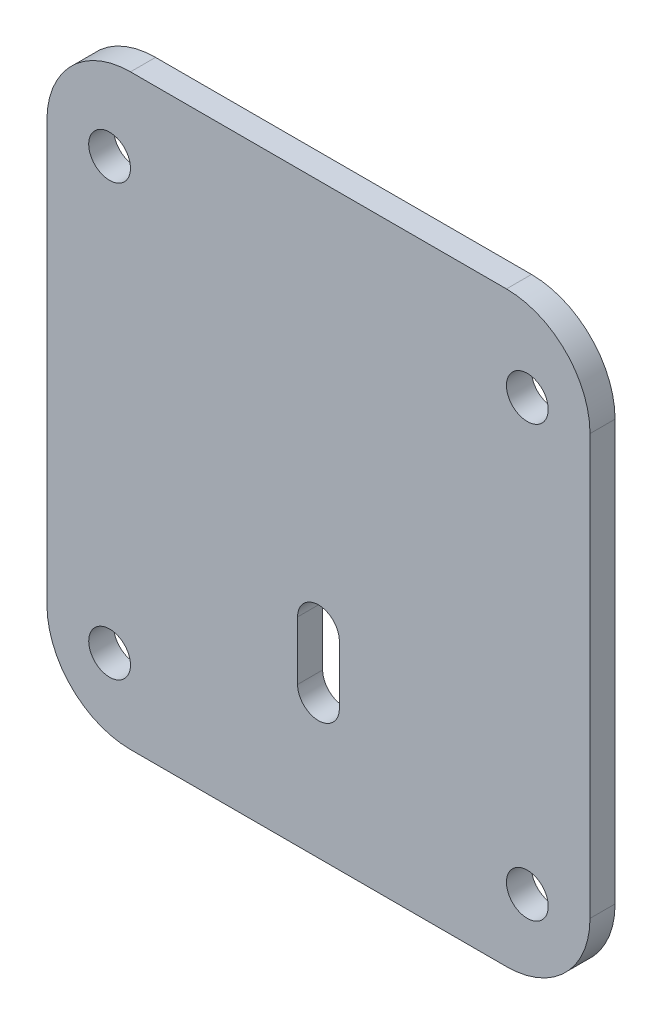
from build123d import *

# Parameters (mm, degrees)
SKETCH1_R           = 2.5
BOSS_EXTRUDE1_DEPTH = 3
FILLET1_R           = 10
FILLET1_R_2         = 15
FILLET1_R_3         = 50
SKETCH2_R           = 1.75
SKETCH2_R_2         = 12
CUT_EXTRUDE1_DEPTH  = 82.389898264
SKETCH4_W           = 65
SKETCH4_H           = 34.30914122
CUT_EXTRUDE2_DEPTH  = 82.389898264
FILLET2_R           = 10
SKETCH5_R           = 2.5
CUT_EXTRUDE3_DEPTH  = 52.820000965


with BuildPart() as part:
    # Sketch1 → Boss-Extrude1 (new body)
    with BuildSketch(Plane.XY):
        Polygon((-32.5, 30), (32.5, 30), (32.5, -62.640754554), (0, -87.640754554), (-32.5, -62.640754554), align=None)
        with Locations((25, 20)):
            Circle(SKETCH1_R, mode=Mode.SUBTRACT)
        with Locations((-25, 20)):
            Circle(SKETCH1_R, mode=Mode.SUBTRACT)
        with BuildLine():
            Line((2.5, -16.5), (2.5, -23.5))
            ThreePointArc((2.5, -23.5), (0, -26), (-2.5, -23.5))
            Line((-2.5, -23.5), (-2.5, -16.5))
            ThreePointArc((-2.5, -16.5), (0, -14), (2.5, -16.5))
        make_face(mode=Mode.SUBTRACT)
    extrude(amount=BOSS_EXTRUDE1_DEPTH)

    # Fillet1
    # the kernel refuses this fillet: 50, 15, 10 mm, written as the material it takes off along each edge
    with BuildSketch(Plane(origin=(32.5, 30, -25), x_dir=(-1, 0, 0), z_dir=(0, 0, 1))) as fillet1_piece_1:
        with BuildLine():
            CenterArc((FILLET1_R, FILLET1_R), FILLET1_R, 180, 90)
            Line((0, FILLET1_R), (0, 0))
            Line((0, 0), (FILLET1_R, 0))
        make_face()
    extrude(amount=53, mode=Mode.SUBTRACT)
    with BuildSketch(Plane(origin=(-32.5, 30, -25), x_dir=(1, 0, 0), z_dir=(0, 0, 1))) as fillet1_piece_2:
        with BuildLine():
            CenterArc((FILLET1_R, -FILLET1_R), FILLET1_R, 90, 90)
            Line((0, -FILLET1_R), (0, 0))
            Line((0, 0), (FILLET1_R, 0))
        make_face()
    extrude(amount=53, mode=Mode.SUBTRACT)
    with BuildSketch(Plane(origin=(-32.5, -62.640754554, -18.465056154), x_dir=(0.7926239891046004, -0.6097107608496921, 0), z_dir=(0, 0, 1)), Plane(origin=(32.5, -62.640754554, -18.465056154), x_dir=(0, 1, 0), z_dir=(0, 0, 1))) as fillet1_piece_3:
        with BuildLine():
            CenterArc((FILLET1_R_2 * 0.492401497451, FILLET1_R_2), FILLET1_R_2, 217.568592029, 52.431407971)
            Line((-FILLET1_R_2 * 0.300222491654, FILLET1_R_2 * 0.39028923915), (0, 0))
            Line((0, 0), (FILLET1_R_2 * 0.492401497451, 0))
        make_face()
    extrude(amount=39.930112309, mode=Mode.SUBTRACT)
    with BuildSketch(Plane(origin=(0, -87.640754554, -96.153846154), x_dir=(0.7926239891046001, 0.6097107608496922, 0), z_dir=(0, 0, 1))) as fillet1_piece_4:
        with BuildLine():
            CenterArc((FILLET1_R_3 * 0.769230769231, FILLET1_R_3), FILLET1_R_3, 194.862815942, 75.137184058)
            Line((-FILLET1_R_3 * 0.197311981699, FILLET1_R_3 * 0.743494423792), (0, 0))
            Line((0, 0), (FILLET1_R_3 * 0.769230769231, 0))
        make_face()
    extrude(amount=195.307692308, mode=Mode.SUBTRACT)

    # Sketch2 → Cut-Extrude1 (cut, through all)
    with BuildSketch(Plane.XY.offset(3)):
        with Locations((12, -42)):
            Circle(SKETCH2_R)
        with Locations((-12, -42)):
            Circle(SKETCH2_R)
        with Locations((-12, -66)):
            Circle(SKETCH2_R)
        with Locations((12, -66)):
            Circle(SKETCH2_R)
        with Locations((0, -54)):
            Circle(SKETCH2_R_2)
    extrude(amount=-CUT_EXTRUDE1_DEPTH, mode=Mode.SUBTRACT)

    # Sketch4 → Cut-Extrude2 (cut, through all)
    with BuildSketch(Plane.XY.offset(3)):
        with Locations((0, -57.40457061)):
            Rectangle(SKETCH4_W, SKETCH4_H)
    extrude(amount=-CUT_EXTRUDE2_DEPTH, mode=Mode.SUBTRACT)

    # Fillet2
    fillet2_edges = [part.edges().sort_by_distance(p)[0] for p in [
        (-32.5, -40.25, 1.5),
        (32.5, -40.25, 1.5),
    ]]
    fillet(fillet2_edges, radius=FILLET2_R)

    # Sketch5 → Cut-Extrude3 (cut, through all)
    with BuildSketch(Plane.XY.offset(3)):
        with Locations((25, -31.5)):
            Circle(SKETCH5_R)
        with Locations(Location((-25, -31.5, 0), (0, 0, 180))):
            Circle(SKETCH5_R)
    extrude(amount=-CUT_EXTRUDE3_DEPTH, mode=Mode.SUBTRACT)


solid = part.part
